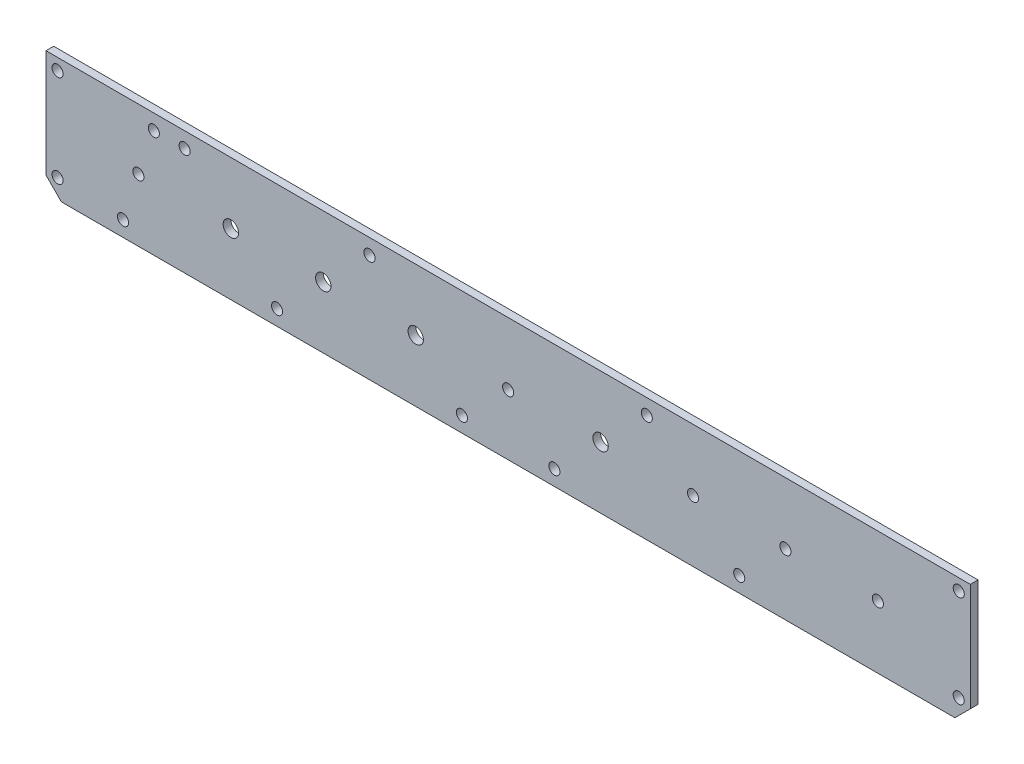
from build123d import *

# Parameters (mm, degrees)
SKETCH1_W           = 381
SKETCH1_H           = 50.8
BOSS_EXTRUDE1_DEPTH = 3.175
CUT_EXTRUDE1_REACH  = 386.385
SKETCH2_R           = 2.286
SKETCH2_R_2         = 3.175


with BuildPart() as part:
    # Sketch1 → Boss-Extrude1 (new body)
    with BuildSketch(Plane.XY):
        with Locations((190.5, 25.4)):
            Rectangle(SKETCH1_W, SKETCH1_H)
    extrude(amount=BOSS_EXTRUDE1_DEPTH)

    # Sketch2 → Cut-Extrude1 (cut, up to next)
    with BuildSketch(Plane.XY.offset(3.175), mode=Mode.PRIVATE) as cut_extrude1_sk1:
        with Locations((38.1, 25.796875)):
            Circle(SKETCH2_R)
    cut_extrude1_tool1 = extrude(cut_extrude1_sk1.sketch, amount=-CUT_EXTRUDE1_REACH, mode=Mode.PRIVATE) & part.part
    # Sketch2 → Cut-Extrude1 (cut, up to next)
    with BuildSketch(Plane.XY.offset(3.175), mode=Mode.PRIVATE) as cut_extrude1_sk2:
        with Locations((190.5, 25.003125)):
            Circle(SKETCH2_R)
    cut_extrude1_tool2 = extrude(cut_extrude1_sk2.sketch, amount=-CUT_EXTRUDE1_REACH, mode=Mode.PRIVATE) & part.part
    # Sketch2 → Cut-Extrude1 (cut, up to next)
    with BuildSketch(Plane.XY.offset(3.175), mode=Mode.PRIVATE) as cut_extrude1_sk3:
        with Locations((114.3, 25.4)):
            Circle(SKETCH2_R_2)
    cut_extrude1_tool3 = extrude(cut_extrude1_sk3.sketch, amount=-CUT_EXTRUDE1_REACH, mode=Mode.PRIVATE) & part.part
    # Sketch2 → Cut-Extrude1 (cut, up to next)
    with BuildSketch(Plane.XY.offset(3.175), mode=Mode.PRIVATE) as cut_extrude1_sk4:
        with Locations((76.2, 25.4)):
            Circle(SKETCH2_R_2)
    cut_extrude1_tool4 = extrude(cut_extrude1_sk4.sketch, amount=-CUT_EXTRUDE1_REACH, mode=Mode.PRIVATE) & part.part
    # Sketch2 → Cut-Extrude1 (cut, up to next)
    with BuildSketch(Plane.XY.offset(3.175), mode=Mode.PRIVATE) as cut_extrude1_sk5:
        with Locations((152.4, 25.4)):
            Circle(SKETCH2_R_2)
    cut_extrude1_tool5 = extrude(cut_extrude1_sk5.sketch, amount=-CUT_EXTRUDE1_REACH, mode=Mode.PRIVATE) & part.part
    # Sketch2 → Cut-Extrude1 (cut, up to next)
    with BuildSketch(Plane.XY.offset(3.175), mode=Mode.PRIVATE) as cut_extrude1_sk6:
        with Locations((228.6, 25.4)):
            Circle(SKETCH2_R_2)
    cut_extrude1_tool6 = extrude(cut_extrude1_sk6.sketch, amount=-CUT_EXTRUDE1_REACH, mode=Mode.PRIVATE) & part.part
    # Sketch2 → Cut-Extrude1 (cut, up to next)
    with BuildSketch(Plane.XY.offset(3.175), mode=Mode.PRIVATE) as cut_extrude1_sk7:
        with Locations((304.8, 25.4)):
            Circle(SKETCH2_R)
    cut_extrude1_tool7 = extrude(cut_extrude1_sk7.sketch, amount=-CUT_EXTRUDE1_REACH, mode=Mode.PRIVATE) & part.part
    # Sketch2 → Cut-Extrude1 (cut, up to next)
    with BuildSketch(Plane.XY.offset(3.175), mode=Mode.PRIVATE) as cut_extrude1_sk8:
        with Locations((266.7, 25.4)):
            Circle(SKETCH2_R)
    cut_extrude1_tool8 = extrude(cut_extrude1_sk8.sketch, amount=-CUT_EXTRUDE1_REACH, mode=Mode.PRIVATE) & part.part
    # Sketch2 → Cut-Extrude1 (cut, up to next)
    with BuildSketch(Plane.XY.offset(3.175), mode=Mode.PRIVATE) as cut_extrude1_sk9:
        with Locations((342.9, 25.796875)):
            Circle(SKETCH2_R)
    cut_extrude1_tool9 = extrude(cut_extrude1_sk9.sketch, amount=-CUT_EXTRUDE1_REACH, mode=Mode.PRIVATE) & part.part
    # Sketch2 → Cut-Extrude1 (cut, up to next)
    with BuildSketch(Plane.XY.offset(3.175), mode=Mode.PRIVATE) as cut_extrude1_sk10:
        with Locations((57.15, 44.45)):
            Circle(SKETCH2_R)
    cut_extrude1_tool10 = extrude(cut_extrude1_sk10.sketch, amount=-CUT_EXTRUDE1_REACH, mode=Mode.PRIVATE) & part.part
    # Sketch2 → Cut-Extrude1 (cut, up to next)
    with BuildSketch(Plane.XY.offset(3.175), mode=Mode.PRIVATE) as cut_extrude1_sk11:
        with Locations((171.45, 6.35)):
            Circle(SKETCH2_R)
    cut_extrude1_tool11 = extrude(cut_extrude1_sk11.sketch, amount=-CUT_EXTRUDE1_REACH, mode=Mode.PRIVATE) & part.part
    # Sketch2 → Cut-Extrude1 (cut, up to next)
    with BuildSketch(Plane.XY.offset(3.175), mode=Mode.PRIVATE) as cut_extrude1_sk12:
        with Locations((209.55, 6.35)):
            Circle(SKETCH2_R)
    cut_extrude1_tool12 = extrude(cut_extrude1_sk12.sketch, amount=-CUT_EXTRUDE1_REACH, mode=Mode.PRIVATE) & part.part
    # Sketch2 → Cut-Extrude1 (cut, up to next)
    with BuildSketch(Plane.XY.offset(3.175), mode=Mode.PRIVATE) as cut_extrude1_sk13:
        with Locations((133.35, 44.45)):
            Circle(SKETCH2_R)
    cut_extrude1_tool13 = extrude(cut_extrude1_sk13.sketch, amount=-CUT_EXTRUDE1_REACH, mode=Mode.PRIVATE) & part.part
    # Sketch2 → Cut-Extrude1 (cut, up to next)
    with BuildSketch(Plane.XY.offset(3.175), mode=Mode.PRIVATE) as cut_extrude1_sk14:
        with Locations((247.65, 44.45)):
            Circle(SKETCH2_R)
    cut_extrude1_tool14 = extrude(cut_extrude1_sk14.sketch, amount=-CUT_EXTRUDE1_REACH, mode=Mode.PRIVATE) & part.part
    # Sketch2 → Cut-Extrude1 (cut, up to next)
    with BuildSketch(Plane.XY.offset(3.175), mode=Mode.PRIVATE) as cut_extrude1_sk15:
        with Locations((95.25, 6.35)):
            Circle(SKETCH2_R)
    cut_extrude1_tool15 = extrude(cut_extrude1_sk15.sketch, amount=-CUT_EXTRUDE1_REACH, mode=Mode.PRIVATE) & part.part
    # Sketch2 → Cut-Extrude1 (cut, up to next)
    with BuildSketch(Plane.XY.offset(3.175), mode=Mode.PRIVATE) as cut_extrude1_sk16:
        with Locations((285.75, 6.35)):
            Circle(SKETCH2_R)
    cut_extrude1_tool16 = extrude(cut_extrude1_sk16.sketch, amount=-CUT_EXTRUDE1_REACH, mode=Mode.PRIVATE) & part.part
    # Sketch2 → Cut-Extrude1 (cut, up to next)
    with BuildSketch(Plane.XY.offset(3.175), mode=Mode.PRIVATE) as cut_extrude1_sk17:
        with Locations((44.45, 44.45)):
            Circle(SKETCH2_R)
    cut_extrude1_tool17 = extrude(cut_extrude1_sk17.sketch, amount=-CUT_EXTRUDE1_REACH, mode=Mode.PRIVATE) & part.part
    # Sketch2 → Cut-Extrude1 (cut, up to next)
    with BuildSketch(Plane.XY.offset(3.175), mode=Mode.PRIVATE) as cut_extrude1_sk18:
        with Locations((31.75, 6.35)):
            Circle(SKETCH2_R)
    cut_extrude1_tool18 = extrude(cut_extrude1_sk18.sketch, amount=-CUT_EXTRUDE1_REACH, mode=Mode.PRIVATE) & part.part
    # Sketch2 → Cut-Extrude1 (cut, up to next)
    with BuildSketch(Plane.XY.offset(3.175), mode=Mode.PRIVATE) as cut_extrude1_sk19:
        with Locations((4.7625, 46.0375)):
            Circle(SKETCH2_R)
    cut_extrude1_tool19 = extrude(cut_extrude1_sk19.sketch, amount=-CUT_EXTRUDE1_REACH, mode=Mode.PRIVATE) & part.part
    # Sketch2 → Cut-Extrude1 (cut, up to next)
    with BuildSketch(Plane.XY.offset(3.175), mode=Mode.PRIVATE) as cut_extrude1_sk20:
        with Locations((4.7625, 7.9375)):
            Circle(SKETCH2_R)
    cut_extrude1_tool20 = extrude(cut_extrude1_sk20.sketch, amount=-CUT_EXTRUDE1_REACH, mode=Mode.PRIVATE) & part.part
    # Sketch2 → Cut-Extrude1 (cut, up to next)
    with BuildSketch(Plane.XY.offset(3.175), mode=Mode.PRIVATE) as cut_extrude1_sk21:
        with Locations((376.2375, 7.9375)):
            Circle(SKETCH2_R)
    cut_extrude1_tool21 = extrude(cut_extrude1_sk21.sketch, amount=-CUT_EXTRUDE1_REACH, mode=Mode.PRIVATE) & part.part
    # Sketch2 → Cut-Extrude1 (cut, up to next)
    with BuildSketch(Plane.XY.offset(3.175), mode=Mode.PRIVATE) as cut_extrude1_sk22:
        with Locations((376.2375, 46.0375)):
            Circle(SKETCH2_R)
    cut_extrude1_tool22 = extrude(cut_extrude1_sk22.sketch, amount=-CUT_EXTRUDE1_REACH, mode=Mode.PRIVATE) & part.part
    # Sketch2 → Cut-Extrude1 (cut, up to next)
    with BuildSketch(Plane.XY.offset(3.175), mode=Mode.PRIVATE) as cut_extrude1_sk23:
        Polygon((0, 6.35), (0, 0), (6.35, 0), align=None)
    cut_extrude1_tool23 = extrude(cut_extrude1_sk23.sketch, amount=-CUT_EXTRUDE1_REACH, mode=Mode.PRIVATE) & part.part
    # Sketch2 → Cut-Extrude1 (cut, up to next)
    with BuildSketch(Plane.XY.offset(3.175), mode=Mode.PRIVATE) as cut_extrude1_sk24:
        Polygon((381, 0), (374.65, 0), (381, 6.35), align=None)
    cut_extrude1_tool24 = extrude(cut_extrude1_sk24.sketch, amount=-CUT_EXTRUDE1_REACH, mode=Mode.PRIVATE) & part.part
    add(cut_extrude1_tool1.solids().sort_by_distance((38.1, 25.796875, 3.175))[0], mode=Mode.SUBTRACT)
    add(cut_extrude1_tool2.solids().sort_by_distance((190.5, 25.003125, 3.175))[0], mode=Mode.SUBTRACT)
    add(cut_extrude1_tool3.solids().sort_by_distance((114.3, 25.4, 3.175))[0], mode=Mode.SUBTRACT)
    add(cut_extrude1_tool4.solids().sort_by_distance((76.2, 25.4, 3.175))[0], mode=Mode.SUBTRACT)
    add(cut_extrude1_tool5.solids().sort_by_distance((152.4, 25.4, 3.175))[0], mode=Mode.SUBTRACT)
    add(cut_extrude1_tool6.solids().sort_by_distance((228.6, 25.4, 3.175))[0], mode=Mode.SUBTRACT)
    add(cut_extrude1_tool7.solids().sort_by_distance((304.8, 25.4, 3.175))[0], mode=Mode.SUBTRACT)
    add(cut_extrude1_tool8.solids().sort_by_distance((266.7, 25.4, 3.175))[0], mode=Mode.SUBTRACT)
    add(cut_extrude1_tool9.solids().sort_by_distance((342.9, 25.796875, 3.175))[0], mode=Mode.SUBTRACT)
    add(cut_extrude1_tool10.solids().sort_by_distance((57.15, 44.45, 3.175))[0], mode=Mode.SUBTRACT)
    add(cut_extrude1_tool11.solids().sort_by_distance((171.45, 6.35, 3.175))[0], mode=Mode.SUBTRACT)
    add(cut_extrude1_tool12.solids().sort_by_distance((209.55, 6.35, 3.175))[0], mode=Mode.SUBTRACT)
    add(cut_extrude1_tool13.solids().sort_by_distance((133.35, 44.45, 3.175))[0], mode=Mode.SUBTRACT)
    add(cut_extrude1_tool14.solids().sort_by_distance((247.65, 44.45, 3.175))[0], mode=Mode.SUBTRACT)
    add(cut_extrude1_tool15.solids().sort_by_distance((95.25, 6.35, 3.175))[0], mode=Mode.SUBTRACT)
    add(cut_extrude1_tool16.solids().sort_by_distance((285.75, 6.35, 3.175))[0], mode=Mode.SUBTRACT)
    add(cut_extrude1_tool17.solids().sort_by_distance((44.45, 44.45, 3.175))[0], mode=Mode.SUBTRACT)
    add(cut_extrude1_tool18.solids().sort_by_distance((31.75, 6.35, 3.175))[0], mode=Mode.SUBTRACT)
    add(cut_extrude1_tool19.solids().sort_by_distance((4.7625, 46.0375, 3.175))[0], mode=Mode.SUBTRACT)
    add(cut_extrude1_tool20.solids().sort_by_distance((4.7625, 7.9375, 3.175))[0], mode=Mode.SUBTRACT)
    add(cut_extrude1_tool21.solids().sort_by_distance((376.2375, 7.9375, 3.175))[0], mode=Mode.SUBTRACT)
    add(cut_extrude1_tool22.solids().sort_by_distance((376.2375, 46.0375, 3.175))[0], mode=Mode.SUBTRACT)
    add(cut_extrude1_tool23.solids().sort_by_distance((2.116667, 2.116667, 3.175))[0], mode=Mode.SUBTRACT)
    add(cut_extrude1_tool24.solids().sort_by_distance((378.883333, 2.116667, 3.175))[0], mode=Mode.SUBTRACT)


solid = part.part
